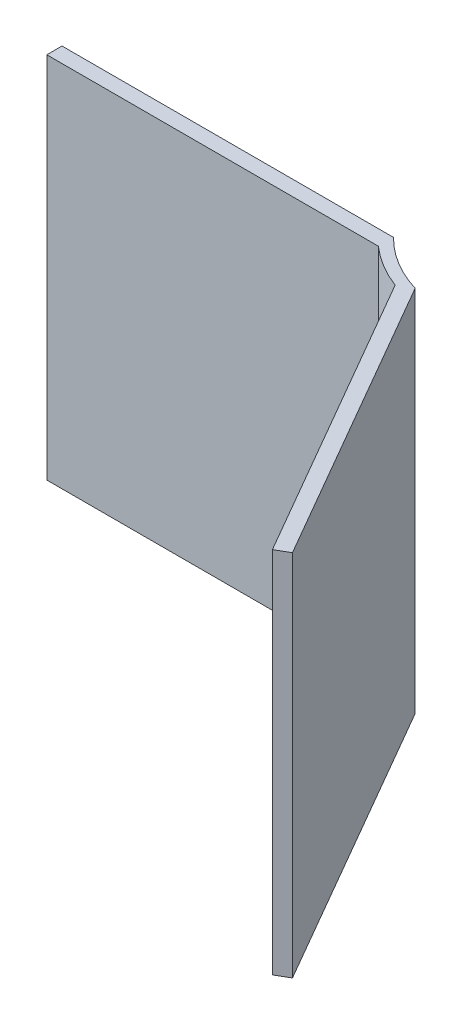
from build123d import *

# Parameters (mm, degrees)
BOSS_EXTRU_1_DEPTH = 100


with BuildPart() as part:
    # Esquisse3 → Boss.-Extru.1 (new body)
    with BuildSketch(Plane(origin=(0, 0, 0), x_dir=(1, 0, 0), z_dir=(0, 1, 0))):
        with BuildLine():
            ThreePointArc((-10.103808925, -33.509894736), (-18.121448463, -29.943498553), (-25, -24.494897428))
            Line((-25, -24.494897428), (-115, -24.494897428))
            Line((-115, -24.494897428), (-115, -28.618176043))
            Line((-115, -28.618176043), (-25, -28.618176043))
            ThreePointArc((-25, -28.618176043), (-19.581111, -32.566548666), (-13.552631037, -35.50107311))
            Line((-13.552631037, -35.50107311), (31.963111135, -114.336651096))
            Line((31.963111135, -114.336651096), (35.411933246, -112.345472721))
            Line((35.411933246, -112.345472721), (-10.103808925, -33.509894736))
        make_face()
    extrude(amount=BOSS_EXTRU_1_DEPTH)


solid = part.part
